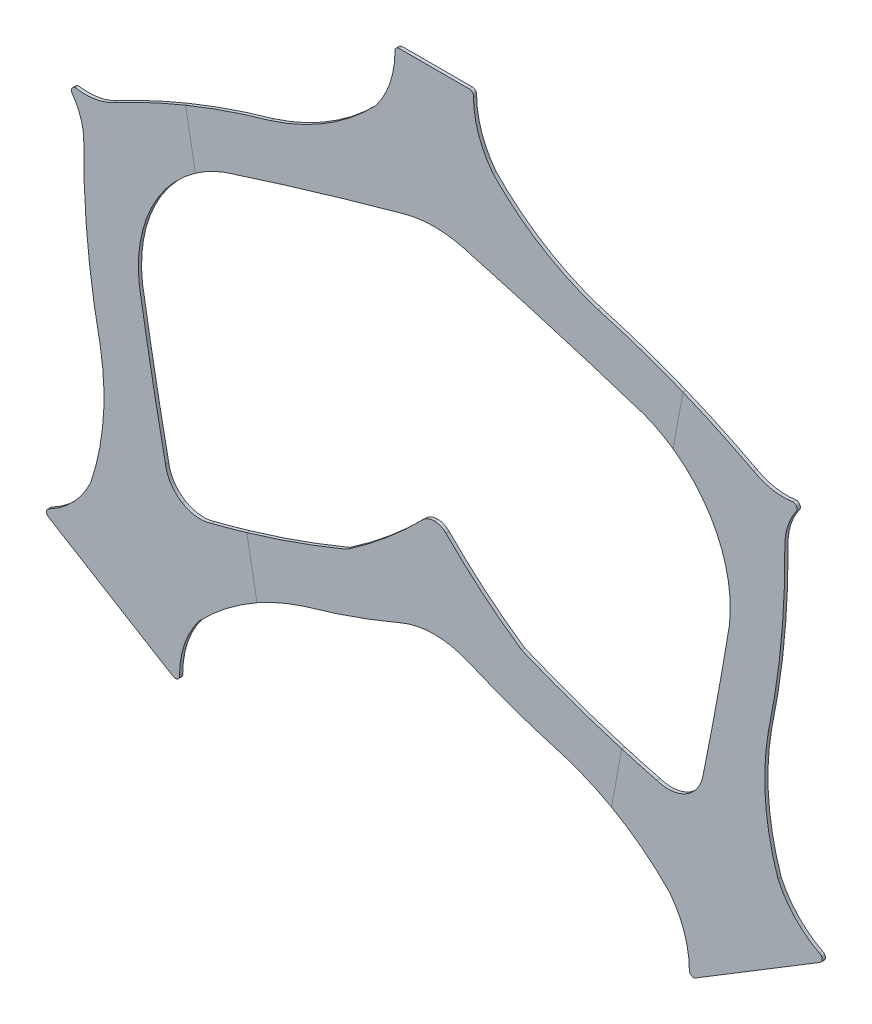
from build123d import *

# Parameters (mm, degrees)
BOSS_EXTRUDE1_DEPTH = 6.35
SPLIT1_DEPTH        = 6.35
SPLIT1_2_DEPTH      = 6.35
SPLIT1_3_DEPTH      = 6.35
SPLIT1_START        = -781.857853319
SPLIT1_4_OUTLINE_W  = 1287
SPLIT1_4_OUTLINE_H  = 6.35
SPLIT1_4_DEPTH      = 1172.504299698
SPLIT1_5_DEPTH      = 6.35


# Read off the part's stored shape, not the designer's step: Split1
with BuildPart() as part:
    # Model → Boss-Extrude1 (new body)
    with BuildSketch(Plane.XY):
        with BuildLine():
            Line((-638.367984426, -394.024277033), (-761.286388803, -319.34348417))
            ThreePointArc((-761.286388803, -319.34348417), (-765.249363496, -311.122215453), (-759.354942783, -304.154415787))
            ThreePointArc((-759.354942783, -304.154415787), (-711.682656668, -268.012776159), (-678.11913533, -218.491517958))
            ThreePointArc((-678.11913533, -218.491517958), (-653.437019788, -98.174481805), (-659.191883423, 24.513241952))
            ThreePointArc((-659.191883423, 24.513241952), (-684.361343993, 188.302016317), (-691.817988241, 353.845553823))
            ThreePointArc((-691.817988241, 353.845553823), (-697.291676319, 393.64117056), (-715.532221879, 429.431321025))
            ThreePointArc((-715.532221879, 429.431321025), (-716.258813808, 433.39071274), (-715.055826906, 437.232267256))
            ThreePointArc((-715.055826906, 437.232267256), (-712.200696082, 440.070038663), (-708.351876516, 441.249575239))
            ThreePointArc((-708.351876516, 441.249575239), (-668.182723515, 441.552097781), (-630.341335993, 455.031035538))
            ThreePointArc((-630.341335993, 455.031035538), (-479.982990088, 524.691872238), (-323.020358084, 577.823750686))
            ThreePointArc((-323.020358084, 577.823750686), (-230.775363979, 617.841419704), (-148.541225202, 675.704181397))
            ThreePointArc((-148.541225202, 675.704181397), (-131.955777097, 690.780334317), (-116.071063152, 706.593093045))
            ThreePointArc((-116.071063152, 706.593093045), (-87.585480923, 759.199524054), (-77.475520929, 818.162679392))
            ThreePointArc((-77.475520929, 818.162679392), (-75.690066507, 825.062407002), (-69.240090661, 828.09422167))
            Line((-69.240090661, 828.09422167), (-0.053809914, 828.115937465))
            Line((-0.053809914, 828.115937465), (69.132470832, 828.13765326))
            ThreePointArc((69.132470832, 828.13765326), (75.584348625, 825.109888153), (77.374133989, 818.211282718))
            ThreePointArc((77.374133989, 818.211282718), (87.521106024, 759.254485511), (116.039706251, 706.665946649))
            ThreePointArc((116.039706251, 706.665946649), (131.934343502, 690.863162642), (148.529252371, 675.797424183))
            ThreePointArc((148.529252371, 675.797424183), (230.799698209, 617.986296251), (323.069795171, 578.026541777))
            ThreePointArc((323.069795171, 578.026541777), (480.065749707, 524.993206857), (630.467795476, 455.426771113))
            ThreePointArc((630.467795476, 455.426771113), (668.317636924, 441.971590887), (708.486971917, 441.694284532))
            ThreePointArc((708.486971917, 441.694284532), (712.336531177, 440.517164279), (715.193442845, 437.681185735))
            ThreePointArc((715.193442845, 437.681185735), (716.39884104, 433.84038715), (715.674734757, 429.880540098))
            ThreePointArc((715.674734757, 429.880540098), (697.456660005, 394.078946209), (692.007954645, 354.279901214))
            ThreePointArc((692.007954645, 354.279901214), (684.655231578, 188.731715428), (659.588594129, 24.927173243))
            ThreePointArc((659.588594129, 24.927173243), (653.910748666, -97.764138948), (678.668388186, -218.065657232))
            ThreePointArc((678.668388186, -218.065657232), (712.262989808, -267.565836225), (759.957954391, -303.677542524))
            ThreePointArc((759.957954391, -303.677542524), (765.856747968, -310.641640604), (761.898934945, -318.865395452))
            Line((761.898934945, -318.865395452), (639.027435546, -393.623335448))
            Line((639.027435546, -393.623335448), (516.155936146, -468.381275443))
            ThreePointArc((516.155936146, -468.381275443), (507.033213291, -468.116029452), (503.559898784, -459.67621227))
            ThreePointArc((503.559898784, -459.67621227), (493.412926748, -400.719415063), (464.894326522, -348.130876201))
            ThreePointArc((464.894326522, -348.130876201), (448.999689271, -332.328092194), (432.404780401, -317.262353736))
            ThreePointArc((432.404780401, -317.262353736), (350.134334566, -259.451225805), (257.864237607, -219.491471331))
            ThreePointArc((257.864237607, -219.491471331), (161.051005017, -189.019470039), (66.450908428, -152.247652124))
            ThreePointArc((66.450908428, -152.247652124), (34.035926816, -142.142455336), (0.249672515, -138.775697944))
            ThreePointArc((0.249672515, -138.775697944), (-33.534461653, -142.163663944), (-65.943093355, -152.289207198))
            ThreePointArc((-65.943093355, -152.289207198), (-160.520087849, -189.120402938), (-257.314172608, -219.65317259))
            ThreePointArc((-257.314172608, -219.65317259), (-349.559166711, -259.670841607), (-431.793305487, -317.533603299))
            ThreePointArc((-431.793305487, -317.533603299), (-448.378753592, -332.609756219), (-464.263467537, -348.422514947))
            ThreePointArc((-464.263467537, -348.422514947), (-492.749049766, -401.028945956), (-502.85900976, -459.992101294))
            ThreePointArc((-502.85900976, -459.992101294), (-506.3270255, -468.434097181), (-515.44958005, -468.705069896))
            Line((-515.44958005, -468.705069896), (-638.367984426, -394.024277033))
        make_face()
        with BuildLine():
            Line((498.327267896, -162.284661886), (498.251688628, -162.330646108))
            ThreePointArc((498.251688628, -162.330646108), (483.560543344, -169.071747961), (467.710528036, -172.24179822))
            ThreePointArc((467.710528036, -172.24179822), (453.546867564, -171.944869226), (439.736818999, -168.78575489))
            ThreePointArc((439.736818999, -168.78575489), (304.635311179, -129.074166548), (172.812587553, -79.55450177))
            ThreePointArc((172.812587553, -79.55450177), (94.93620934, -20.796551659), (23.238928571, 45.360284081))
            ThreePointArc((23.238928571, 45.360284081), (12.682899079, 52.47774836), (0.188874949, 54.924668346))
            ThreePointArc((0.188874949, 54.924668346), (-12.303610669, 52.469905737), (-22.855170103, 45.345816329))
            ThreePointArc((-22.855170103, 45.345816329), (-94.510906889, -20.856014238), (-172.35038454, -79.662839553))
            ThreePointArc((-172.35038454, -79.662839553), (-304.141996297, -129.265246094), (-439.218548607, -169.061636385))
            ThreePointArc((-439.218548607, -169.061636385), (-453.026611322, -172.229419336), (-467.190082606, -172.535239489))
            ThreePointArc((-467.190082606, -172.535239489), (-483.042084786, -169.375139678), (-497.737458891, -162.643261498))
            Line((-497.737458891, -162.643261498), (-497.813067011, -162.59732473))
            ThreePointArc((-497.813067011, -162.59732473), (-519.577528179, -141.73147249), (-530.473668716, -113.618313986))
            ThreePointArc((-530.473668716, -113.618313986), (-557.686932125, 26.474784935), (-582.350395553, 167.03918883))
            ThreePointArc((-582.350395553, 167.03918883), (-578.065588789, 253.770219076), (-545.759236039, 334.373759622))
            ThreePointArc((-545.759236039, 334.373759622), (-489.108364583, 400.186447909), (-414.107553732, 443.952982479))
            ThreePointArc((-414.107553732, 443.952982479), (-237.176009353, 499.162492838), (-58.991018122, 550.181806148))
            ThreePointArc((-58.991018122, 550.181806148), (-29.745116882, 556.118351155), (0.030939182, 558.106262423))
            ThreePointArc((0.030939182, 558.106262423), (29.808237287, 556.137043422), (59.057859422, 550.218858656))
            ThreePointArc((59.057859422, 550.218858656), (237.274842843, 499.311410764), (414.241010049, 444.2129798))
            ThreePointArc((414.241010049, 444.2129798), (489.2692805, 400.493535502), (545.961454613, 334.716422682))
            ThreePointArc((545.961454613, 334.716422682), (578.318399751, 254.133178284), (582.657650946, 167.404854908))
            ThreePointArc((582.657650946, 167.404854908), (558.082431475, 26.824996256), (530.957116664, -113.285158148))
            ThreePointArc((530.957116664, -113.285158148), (520.078626268, -141.405151149), (498.327267896, -162.284661886))
        make_face(mode=Mode.SUBTRACT)
    extrude(amount=BOSS_EXTRUDE1_DEPTH)

    # Split1 4 outline → Split1 4 (cut)
    with BuildSketch(Plane(origin=(0, 0, 0), x_dir=(0.17746085670516612, 0.9841278597506874, 0), z_dir=(0.9841278597506874, -0.1774608567051661, 0)).offset(SPLIT1_START)):
        with Locations((121.5, 3.175)):
            Rectangle(SPLIT1_4_OUTLINE_W, SPLIT1_4_OUTLINE_H)
    extrude(amount=SPLIT1_4_DEPTH, mode=Mode.SUBTRACT)

    # Split1 5 outline → Split1 5 (cut)
    with BuildSketch(Plane.XY):
        with BuildLine():
            ThreePointArc((-65.943093355, -152.289207198), (-33.534461652, -142.163663944), (0.249672515, -138.775697944))
            ThreePointArc((0.249672515, -138.775697944), (34.035926816, -142.142455336), (66.450908428, -152.247652124))
            ThreePointArc((66.450908428, -152.247652124), (161.051005017, -189.019470039), (257.864237607, -219.491471331))
            ThreePointArc((257.864237607, -219.491471331), (305.031494723, -237.123910925), (350.159304792, -259.465214113))
            Line((350.159304792, -259.465214113), (369.966150257, -149.62426779))
            ThreePointArc((369.966150257, -149.62426779), (270.432887756, -117.280612064), (172.812587553, -79.55450177))
            ThreePointArc((172.812587553, -79.55450177), (94.93620934, -20.796551659), (23.238928571, 45.360284081))
            ThreePointArc((23.238928571, 45.360284081), (12.682899079, 52.47774836), (0.188874949, 54.924668346))
            ThreePointArc((0.188874949, 54.924668346), (-12.303610669, 52.469905737), (-22.855170103, 45.345816329))
            ThreePointArc((-22.855170103, 45.345816329), (-94.510906889, -20.856014238), (-172.35038454, -79.662839553))
            ThreePointArc((-172.35038454, -79.662839553), (-304.141996297, -129.265246094), (-439.218548607, -169.061636385))
            ThreePointArc((-439.218548607, -169.061636385), (-469.190114459, -172.345049244), (-497.737458891, -162.643261498))
            Line((-497.737458891, -162.643261498), (-497.813067011, -162.59732473))
            ThreePointArc((-497.813067011, -162.59732473), (-519.577528179, -141.73147249), (-530.473668716, -113.618313986))
            ThreePointArc((-530.473668716, -113.618313986), (-557.686932125, 26.474784935), (-582.350395553, 167.03918883))
            ThreePointArc((-582.350395553, 167.03918883), (-578.065588789, 253.770219076), (-545.759236039, 334.373759622))
            ThreePointArc((-545.759236039, 334.373759622), (-489.108364582, 400.18644791), (-414.107553732, 443.952982479))
            ThreePointArc((-414.107553732, 443.952982479), (-237.176009353, 499.162492838), (-58.991018122, 550.181806148))
            ThreePointArc((-58.991018122, 550.181806148), (-29.745116882, 556.118351155), (0.030939182, 558.106262423))
            ThreePointArc((0.030939182, 558.106262423), (29.808237287, 556.137043422), (59.057859422, 550.218858656))
            ThreePointArc((59.057859422, 550.218858656), (237.274842843, 499.311410764), (414.241010049, 444.2129798))
            ThreePointArc((414.241010049, 444.2129798), (443.853765702, 430.863982072), (471.59422819, 413.964935392))
            Line((471.59422819, 413.964935392), (490.832378328, 520.652121925))
            ThreePointArc((490.832378328, 520.652121925), (407.775994413, 551.751358688), (323.069795171, 578.026541777))
            ThreePointArc((323.069795171, 578.026541777), (211.498540436, 629.38071525), (116.039706251, 706.665946649))
            ThreePointArc((116.039706251, 706.665946649), (87.521106024, 759.25448551), (77.374133989, 818.211282718))
            ThreePointArc((77.374133989, 818.211282718), (75.584348625, 825.109888153), (69.132470832, 828.13765326))
            Line((69.132470832, 828.13765326), (-69.240090661, 828.09422167))
            ThreePointArc((-69.240090661, 828.09422167), (-75.690066507, 825.062407002), (-77.475520929, 818.162679392))
            ThreePointArc((-77.475520929, 818.162679392), (-87.585480923, 759.199524054), (-116.071063152, 706.593093045))
            ThreePointArc((-116.071063152, 706.593093045), (-211.481362839, 629.247952732), (-323.020358084, 577.823750686))
            ThreePointArc((-323.020358084, 577.823750686), (-479.982990088, 524.691872238), (-630.341335993, 455.031035538))
            ThreePointArc((-630.341335993, 455.031035538), (-668.182723515, 441.552097781), (-708.351876516, 441.249575239))
            ThreePointArc((-708.351876516, 441.249575239), (-715.055826906, 437.232267256), (-715.532221879, 429.431321025))
            ThreePointArc((-715.532221879, 429.431321025), (-697.291676319, 393.64117056), (-691.817988241, 353.845553823))
            ThreePointArc((-691.817988241, 353.845553823), (-684.361343993, 188.302016317), (-659.191883423, 24.513241952))
            ThreePointArc((-659.191883423, 24.513241952), (-653.437019788, -98.174481805), (-678.11913533, -218.491517958))
            ThreePointArc((-678.11913533, -218.491517958), (-711.682656668, -268.012776159), (-759.354942783, -304.154415787))
            ThreePointArc((-759.354942783, -304.154415787), (-765.249363496, -311.122215453), (-761.286388803, -319.34348417))
            Line((-761.286388803, -319.34348417), (-515.44958005, -468.705069896))
            ThreePointArc((-515.44958005, -468.705069896), (-506.3270255, -468.434097181), (-502.85900976, -459.992101294))
            ThreePointArc((-502.85900976, -459.992101294), (-492.749049766, -401.028945956), (-464.263467537, -348.422514947))
            ThreePointArc((-464.263467537, -348.422514947), (-368.853167852, -271.077374635), (-257.314172608, -219.65317259))
            ThreePointArc((-257.314172608, -219.65317259), (-160.520087849, -189.120402938), (-65.943093355, -152.289207198))
        make_face()
    extrude(amount=SPLIT1_5_DEPTH, mode=Mode.SUBTRACT)


with BuildPart() as body_2:
    # Split1 outline → Split1 (new body)
    with BuildSketch(Plane.XY):
        with BuildLine():
            ThreePointArc((-464.263467537, -348.422514947), (-410.417039433, -299.994956425), (-350.070434299, -259.958054786))
            Line((-350.070434299, -259.958054786), (-369.900800355, -149.98667255))
            ThreePointArc((-369.900800355, -149.98667255), (-404.470264766, -159.849066229), (-439.218548607, -169.061636385))
            ThreePointArc((-439.218548607, -169.061636385), (-469.190114459, -172.345049244), (-497.737458891, -162.643261498))
            Line((-497.737458891, -162.643261498), (-497.813067011, -162.59732473))
            ThreePointArc((-497.813067011, -162.59732473), (-519.577528179, -141.73147249), (-530.473668716, -113.618313986))
            ThreePointArc((-530.473668716, -113.618313986), (-557.686932125, 26.474784935), (-582.350395553, 167.03918883))
            ThreePointArc((-582.350395553, 167.03918883), (-578.065588789, 253.770219076), (-545.759236039, 334.373759622))
            ThreePointArc((-545.759236039, 334.373759622), (-512.779474489, 377.864428576), (-471.529768148, 413.607465447))
            Line((-471.529768148, 413.607465447), (-490.774769517, 520.332646195))
            ThreePointArc((-490.774769517, 520.332646195), (-561.373841233, 489.425393525), (-630.341335993, 455.031035538))
            ThreePointArc((-630.341335993, 455.031035538), (-668.182723515, 441.552097781), (-708.351876516, 441.249575239))
            ThreePointArc((-708.351876516, 441.249575239), (-715.055826906, 437.232267256), (-715.532221879, 429.431321025))
            ThreePointArc((-715.532221879, 429.431321025), (-697.291676319, 393.64117056), (-691.817988241, 353.845553823))
            ThreePointArc((-691.817988241, 353.845553823), (-684.361343993, 188.302016317), (-659.191883423, 24.513241952))
            ThreePointArc((-659.191883423, 24.513241952), (-653.437019788, -98.174481805), (-678.11913533, -218.491517958))
            ThreePointArc((-678.11913533, -218.491517958), (-711.682656668, -268.012776159), (-759.354942783, -304.154415787))
            ThreePointArc((-759.354942783, -304.154415787), (-765.249363496, -311.122215453), (-761.286388803, -319.34348417))
            Line((-761.286388803, -319.34348417), (-515.44958005, -468.705069896))
            ThreePointArc((-515.44958005, -468.705069896), (-506.3270255, -468.434097181), (-502.85900976, -459.992101294))
            ThreePointArc((-502.85900976, -459.992101294), (-492.749049766, -401.028945956), (-464.263467537, -348.422514947))
        make_face()
    extrude(amount=SPLIT1_DEPTH)


with BuildPart() as body_3:
    # Split1 2 outline → Split1 2 (new body)
    with BuildSketch(Plane.XY):
        with BuildLine():
            Line((-369.900800355, -149.98667255), (-350.070434299, -259.958054786))
            ThreePointArc((-350.070434299, -259.958054786), (-304.726176416, -237.426294216), (-257.314172608, -219.65317259))
            ThreePointArc((-257.314172608, -219.65317259), (-160.520087849, -189.120402938), (-65.943093355, -152.289207198))
            ThreePointArc((-65.943093355, -152.289207198), (-33.534461652, -142.163663944), (0.249672515, -138.775697944))
            ThreePointArc((0.249672515, -138.775697944), (34.035926816, -142.142455336), (66.450908428, -152.247652124))
            ThreePointArc((66.450908428, -152.247652124), (161.051005017, -189.019470039), (257.864237607, -219.491471331))
            ThreePointArc((257.864237607, -219.491471331), (305.031494723, -237.123910924), (350.159304792, -259.465214113))
            Line((350.159304792, -259.465214113), (369.966150257, -149.62426779))
            ThreePointArc((369.966150257, -149.62426779), (270.432887757, -117.280612064), (172.812587553, -79.55450177))
            ThreePointArc((172.812587553, -79.55450177), (94.93620934, -20.796551659), (23.238928571, 45.360284081))
            ThreePointArc((23.238928571, 45.360284081), (12.682899079, 52.47774836), (0.188874949, 54.924668346))
            ThreePointArc((0.188874949, 54.924668346), (-12.303610669, 52.469905737), (-22.855170103, 45.345816329))
            ThreePointArc((-22.855170103, 45.345816329), (-94.510906889, -20.856014238), (-172.35038454, -79.662839553))
            ThreePointArc((-172.35038454, -79.662839553), (-270.163533959, -117.52732567), (-369.900800355, -149.98667255))
        make_face()
    extrude(amount=SPLIT1_2_DEPTH)


with BuildPart() as body_4:
    # Split1 3 outline → Split1 3 (new body)
    with BuildSketch(Plane.XY):
        with BuildLine():
            Line((-490.774769517, 520.332646195), (-471.529768148, 413.607465447))
            ThreePointArc((-471.529768148, 413.607465447), (-443.759378978, 430.560325874), (-414.107553732, 443.952982479))
            ThreePointArc((-414.107553732, 443.952982479), (-237.176009353, 499.162492838), (-58.991018122, 550.181806148))
            ThreePointArc((-58.991018122, 550.181806148), (-29.745116882, 556.118351155), (0.030939182, 558.106262423))
            ThreePointArc((0.030939182, 558.106262423), (29.808237287, 556.137043422), (59.057859422, 550.218858656))
            ThreePointArc((59.057859422, 550.218858656), (237.274842843, 499.311410764), (414.241010049, 444.2129798))
            ThreePointArc((414.241010049, 444.2129798), (443.853765702, 430.863982071), (471.59422819, 413.964935392))
            Line((471.59422819, 413.964935392), (490.832378328, 520.652121925))
            ThreePointArc((490.832378328, 520.652121925), (407.775994413, 551.751358688), (323.069795171, 578.026541777))
            ThreePointArc((323.069795171, 578.026541777), (211.498540436, 629.38071525), (116.039706251, 706.665946649))
            ThreePointArc((116.039706251, 706.665946649), (87.521106024, 759.25448551), (77.374133989, 818.211282718))
            ThreePointArc((77.374133989, 818.211282718), (75.584348625, 825.109888153), (69.132470832, 828.13765326))
            Line((69.132470832, 828.13765326), (-69.240090661, 828.09422167))
            ThreePointArc((-69.240090661, 828.09422167), (-75.690066507, 825.062407002), (-77.475520929, 818.162679392))
            ThreePointArc((-77.475520929, 818.162679392), (-87.585480923, 759.199524054), (-116.071063152, 706.593093045))
            ThreePointArc((-116.071063152, 706.593093045), (-211.481362839, 629.247952732), (-323.020358084, 577.823750686))
            ThreePointArc((-323.020358084, 577.823750686), (-407.724289496, 551.49051742), (-490.774769517, 520.332646195))
        make_face()
    extrude(amount=SPLIT1_3_DEPTH)


solid = Compound([part.part, body_2.part, body_3.part, body_4.part])
